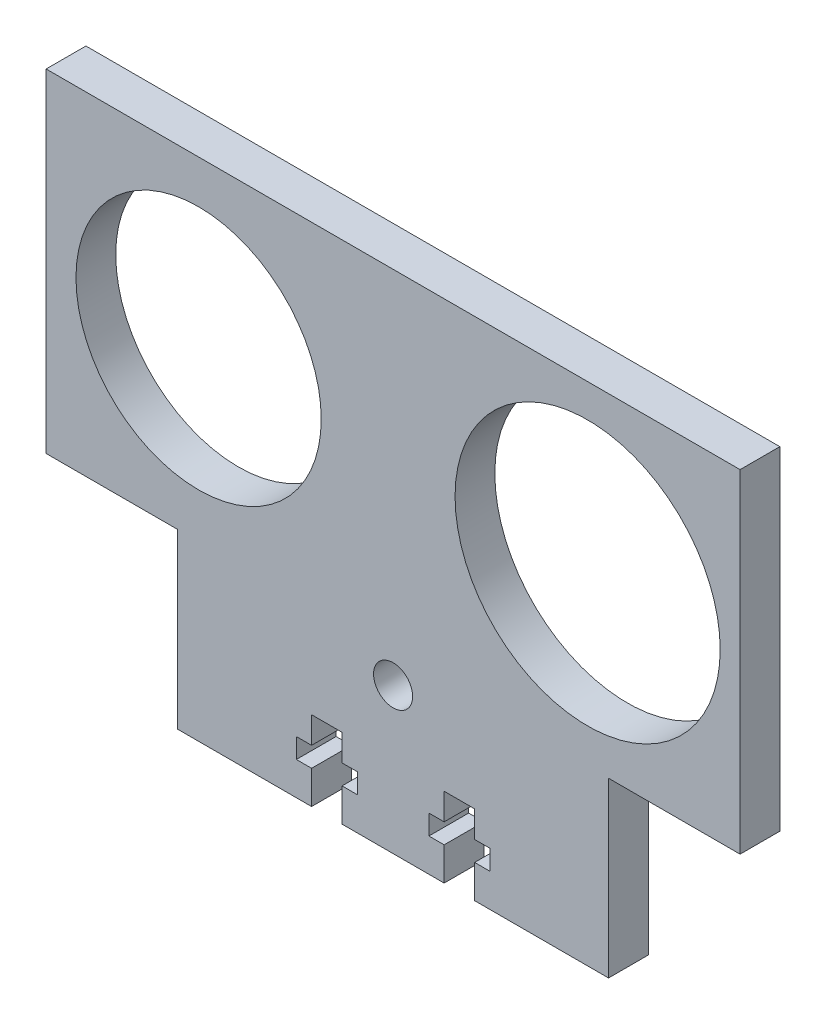
from build123d import *

# Parameters (mm, degrees)
SKETCH1_R           = 2.95
SKETCH1_R_2         = 20
SKETCH1_R_3         = 18.5
BOSS_EXTRUDE1_DEPTH = 6
CUT_EXTRUDE2_DEPTH  = 76.692558526


with BuildPart() as part:
    # Sketch1 → Boss-Extrude1 (new body)
    with BuildSketch(Plane.XY):
        Polygon((-32.5, 4.1), (-32.5, -22), (32.5, -22), (32.5, 4.1), (52.344931419, 4.1), (52.344931419, 54.344931419), (-52.344931419, 54.344931419), (-52.344931419, 4.1), align=None)
        Circle(SKETCH1_R, mode=Mode.SUBTRACT)
        with Locations((29.344931419, 29.344931419)):
            Circle(SKETCH1_R_2, mode=Mode.SUBTRACT)
        with Locations((-29.344931419, 29.344931419)):
            Circle(SKETCH1_R_3, mode=Mode.SUBTRACT)
    extrude(amount=BOSS_EXTRUDE1_DEPTH)

    # Sketch3 → Cut-Extrude2 (cut, through all)
    with BuildSketch(Plane.XY.offset(6)):
        Polygon((-12.3, -22), (-7.7, -22), (-7.7, -17), (-5.4, -17), (-5.4, -14), (-7.7, -14), (-7.7, -10), (-12.3, -10), (-12.3, -14), (-14.6, -14), (-14.6, -17), (-12.3, -17), align=None)
        Polygon((7.7, -14), (7.7, -10), (12.3, -10), (12.3, -14), (14.6, -14), (14.6, -17), (12.3, -17), (12.3, -22), (7.7, -22), (7.7, -17), (5.4, -17), (5.4, -14), align=None)
    extrude(amount=-CUT_EXTRUDE2_DEPTH, mode=Mode.SUBTRACT)


solid = part.part
